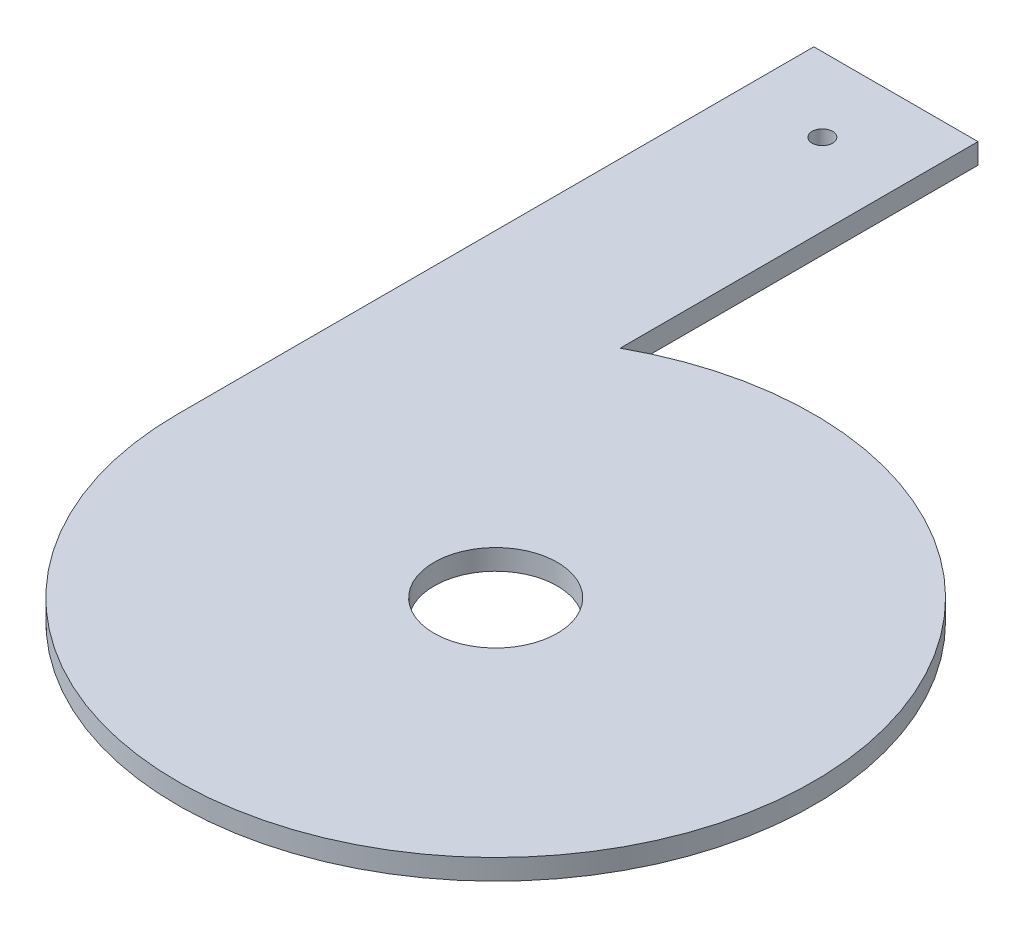
from build123d import *

# Parameters (mm, degrees)
SKETCH1_R           = 31
BOSS_EXTRUDE1_DEPTH = 2
SKETCH2_R           = 6
CUT_EXTRUDE1_DEPTH  = 2
SKETCH3_W           = 16
SKETCH3_H           = 62
BOSS_EXTRUDE2_DEPTH = 2
CUT_EXTRUDE2_REACH  = 71.347
SKETCH11_R          = 1


with BuildPart() as part:
    # Sketch1 → Boss-Extrude1 (new body)
    with BuildSketch(Plane(origin=(0, 0, 0), x_dir=(1, 0, 0), z_dir=(0, 1, 0))):
        Circle(SKETCH1_R)
    extrude(amount=BOSS_EXTRUDE1_DEPTH)

    # Sketch2 → Cut-Extrude1 (cut)
    with BuildSketch(Plane(origin=(0, 2, 0), x_dir=(1, 0, 0), z_dir=(0, 1, 0))):
        Circle(SKETCH2_R)
    extrude(amount=-CUT_EXTRUDE1_DEPTH, mode=Mode.SUBTRACT)

    # Sketch3 → Boss-Extrude2 (add)
    with BuildSketch(Plane(origin=(0, 2, 0), x_dir=(1, 0, 0), z_dir=(0, 1, 0))):
        with Locations((-23, 31)):
            Rectangle(SKETCH3_W, SKETCH3_H)
    extrude(amount=-BOSS_EXTRUDE2_DEPTH)

    # Sketch11 → Cut-Extrude2 (cut, up to next)
    with BuildSketch(Plane(origin=(0, 2, 0), x_dir=(1, 0, 0), z_dir=(0, 1, 0)), mode=Mode.PRIVATE) as cut_extrude2_sk1:
        with Locations((-22.95, 54.78)):
            Circle(SKETCH11_R)
    cut_extrude2_tool1 = extrude(cut_extrude2_sk1.sketch, amount=-CUT_EXTRUDE2_REACH, mode=Mode.PRIVATE) & part.part
    add(cut_extrude2_tool1.solids().sort_by_distance((-22.95, 2, -54.78))[0], mode=Mode.SUBTRACT)


solid = part.part
